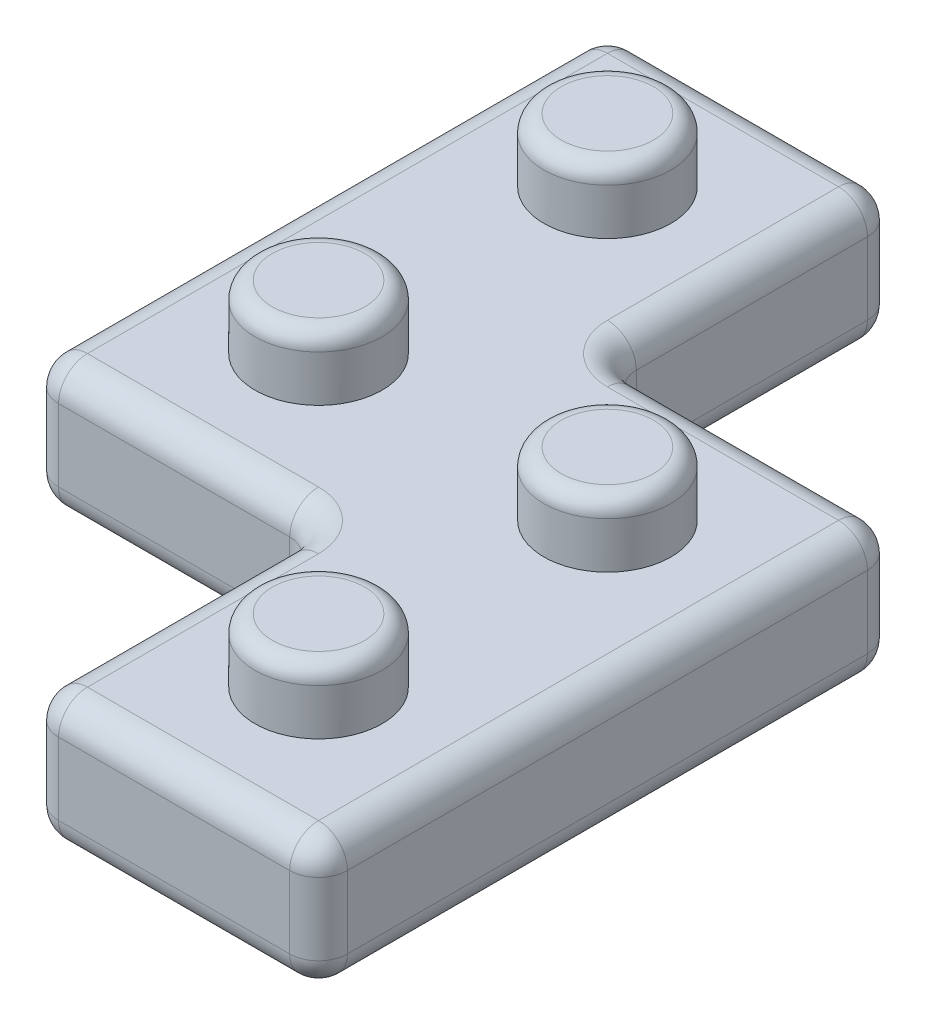
from build123d import *

# Parameters (mm, degrees)
BOSS_EXTRUDE1_DEPTH = 5.715
SKETCH2_R           = 2.794
BOSS_EXTRUDE2_DEPTH = 2.794
FILLET4_R           = 1.27
FILLET5_R           = 1.27
FILLET7_R           = 0.762


with BuildPart() as part:
    # Sketch1 → Boss-Extrude1 (new body)
    with BuildSketch(Plane(origin=(0, 0, 0), x_dir=(1, 0, 0), z_dir=(0, 1, 0))):
        with BuildLine():
            Line((-11.43, 12.7), (-1.27, 12.7))
            ThreePointArc((-1.27, 12.7), (-0.371974388, 12.328025612), (0, 11.43))
            Line((0, 11.43), (0, 1.27))
            ThreePointArc((0, 1.27), (0.371974388, 0.371974388), (1.27, 0))
            Line((1.27, 0), (11.43, 0))
            ThreePointArc((11.43, 0), (12.328025612, -0.371974388), (12.7, -1.27))
            Line((12.7, -1.27), (12.7, -24.13))
            ThreePointArc((12.7, -24.13), (12.328025612, -25.028025612), (11.43, -25.4))
            Line((11.43, -25.4), (1.27, -25.4))
            ThreePointArc((1.27, -25.4), (0.371974388, -25.028025612), (0, -24.13))
            Line((0, -24.13), (0, -13.97))
            ThreePointArc((0, -13.97), (-0.371974388, -13.071974388), (-1.27, -12.7))
            Line((-1.27, -12.7), (-11.43, -12.7))
            ThreePointArc((-11.43, -12.7), (-12.328025612, -12.328025612), (-12.7, -11.43))
            Line((-12.7, -11.43), (-12.7, 11.43))
            ThreePointArc((-12.7, 11.43), (-12.328025612, 12.328025612), (-11.43, 12.7))
        make_face()
    extrude(amount=-BOSS_EXTRUDE1_DEPTH)

    # Sketch2 → Boss-Extrude2 (add)
    with BuildSketch(Plane(origin=(0, 0, 0), x_dir=(1, 0, 0), z_dir=(0, 1, 0))):
        with Locations((-6.35, 6.35)):
            Circle(SKETCH2_R)
        with Locations((-6.35, -6.35)):
            Circle(SKETCH2_R)
        with Locations((6.35, -6.35)):
            Circle(SKETCH2_R)
        with Locations((6.35, -19.05)):
            Circle(SKETCH2_R)
    extrude(amount=BOSS_EXTRUDE2_DEPTH)

    # Fillet4
    fillet4_edges = [part.edges().sort_by_distance(p)[0] for p in [
        (-6.35, 0, 12.7),
        (0, 0, 19.05),
        (6.35, 0, 25.4),
        (12.7, 0, 12.7),
        (6.35, 0, 0),
        (0, 0, -6.35),
        (-6.35, 0, -12.7),
        (-12.7, 0, 0),
        (-12.328025612, 0, 12.328025612),
        (-0.371974388, 0, 13.071974388),
        (0.371974388, 0, 25.028025612),
        (12.328025612, 0, 25.028025612),
        (12.328025612, 0, 0.371974388),
        (0.371974388, 0, -0.371974388),
        (-0.371974388, 0, -12.328025612),
        (-12.328025612, 0, -12.328025612),
    ]]
    fillet(fillet4_edges, radius=FILLET4_R)

    # Fillet5
    fillet5_edges = [part.edges().sort_by_distance(p)[0] for p in [
        (0, -5.715, -6.35),
        (6.35, -5.715, 0),
        (12.7, -5.715, 12.7),
        (6.35, -5.715, 25.4),
        (0, -5.715, 19.05),
        (-6.35, -5.715, 12.7),
        (-12.7, -5.715, 0),
        (-6.35, -5.715, -12.7),
        (-12.328025612, -5.715, -12.328025612),
        (-12.328025612, -5.715, 12.328025612),
        (-0.371974388, -5.715, 13.071974388),
        (0.371974388, -5.715, 25.028025612),
        (12.328025612, -5.715, 25.028025612),
        (12.328025612, -5.715, 0.371974388),
        (0.371974388, -5.715, -0.371974388),
        (-0.371974388, -5.715, -12.328025612),
    ]]
    fillet(fillet5_edges, radius=FILLET5_R)

    # Fillet7
    fillet7_edges = [part.edges().sort_by_distance(p)[0] for p in [
        (3.556, 2.794, 19.05),
        (3.556, 2.794, 6.35),
        (-9.144, 2.794, 6.35),
        (-9.144, 2.794, -6.35),
    ]]
    fillet(fillet7_edges, radius=FILLET7_R)


solid = part.part
